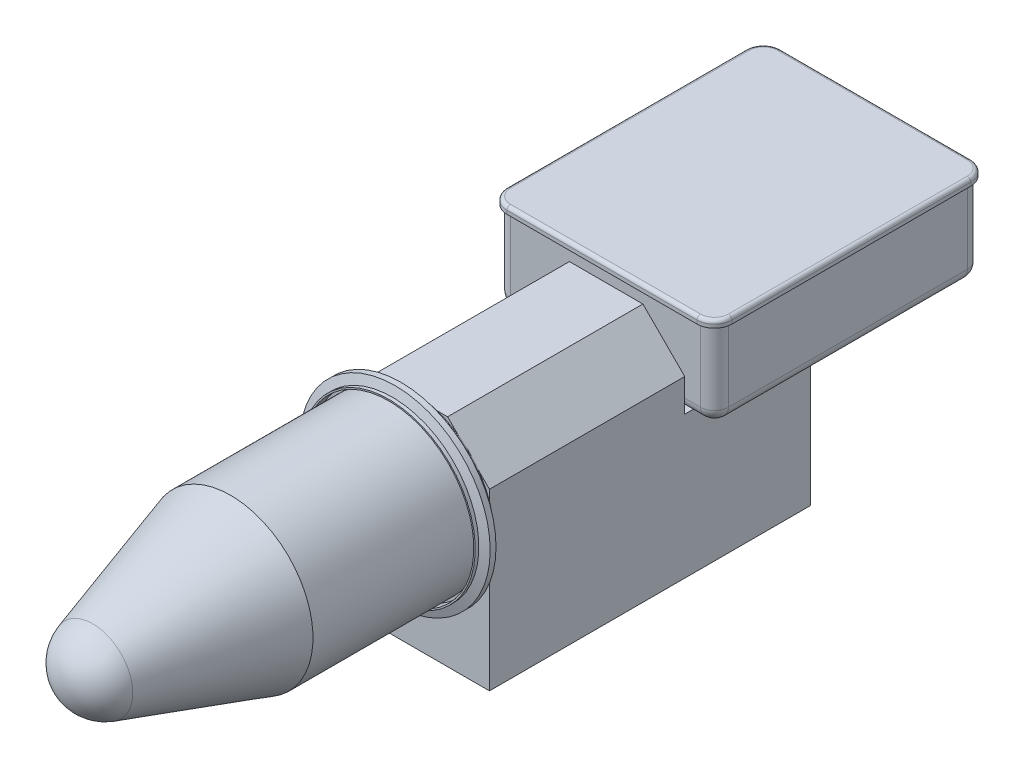
from build123d import *

# Parameters (mm, degrees)
CE_00_PYRAMID_FACE_DEPTH    = 152.4
CP_00_PYRAMID_FACES_COUNT   = 4
BOSS_EXTRUDE1_DEPTH         = 584.2
SKETCH12_W                  = 287.368195874
SKETCH12_H                  = 287.368195874
CUT_EXTRUDE6_DEPTH          = 254
SHELL8_START                = -1180.42182
SHELL8_OUTLINE_W            = 281.686
SHELL8_OUTLINE_H            = 254
SHELL8_DEPTH                = 565.15
SHELL8_START_2              = -959.74662
SHELL8_2_DEPTH              = 344.4748
SHELL8_START_3              = -615.27182
SHELL8_3_OUTLINE_R          = 101.6
SHELL8_3_DEPTH              = 6.35
SHELL8_START_4              = -1193.12182
SHELL8_4_OUTLINE_R          = 34.1376
SHELL8_4_DEPTH              = 12.7
SH_00_DOME_SHELL_T          = -2.54
SKETCH8_W                   = 485.78
SKETCH8_H                   = 169.88
BE_00_PAX_CASE_BOTTOM_DEPTH = 198.4375
FILLET1_R                   = 25.4
FILLET2_R                   = 22.86
BE_00_PAX_CASE_TOP_DEPTH    = 12.7
FILLET3_R                   = 6.35
SKETCH16_R                  = 25.4
SKETCH16_R_2                = 23.749


# Read off the part's stored shape, not the designer's step: Shell8
with BuildPart() as part:
    # Sketch1 → BR-00 Base Plate & Feed (revolve)
    with BuildSketch(Plane(origin=(0, 0, 0), x_dir=(0, 0, -1), z_dir=(1, 0, 0)), mode=Mode.PRIVATE) as br_00_base_plate_feed_sk:
        Polygon((586.69682, 155), (586.69682, 25.4), (561.29682, 25.4), (561.29682, 139.7), (17.145, 24.036960114), (17.145, 0), (862.92182, 0), (862.92182, 76.2), (850.22182, 76.2), (850.22182, 28.18076073), (698.204523227, 28.18076073), (698.204523227, 82.241223084), (608.92182, 82.241223084), (608.92182, 152.46), (597.072242205, 152.46), (597.072242205, 155), (603.678132318, 155), (603.678132318, 157.578507293), (597.072242205, 157.578507293), (592.006037356, 173.170682553), (581.387602644, 173.170682553), (576.321397795, 157.578507293), (569.715507682, 157.578507293), (569.715507682, 155), align=None)
    revolve(br_00_base_plate_feed_sk.sketch.rotate(Axis((0, 0, -724.182594249), (0, 0, 1)), 90), axis=Axis((0, 0, -724.182594249), (0, 0, 1)))

    # Sketch2 → CE-00 Pyramid Face (cut, symmetric)
    with BuildSketch(Plane(origin=(0, 0, 0), x_dir=(0, 0, -1), z_dir=(1, 0, 0))):
        Polygon((14.605, 2.575255553), (558.1142, 98.410591777), (558.1142, 230.90250219), (14.605, 230.90250219), align=None)
    ce_00_pyramid_face = extrude(amount=CE_00_PYRAMID_FACE_DEPTH, both=True, mode=Mode.SUBTRACT)

    # CP-00 Pyramid Faces: CE-00 Pyramid Face ×4 about axis
    cp_00_pyramid_faces_axis = Axis((0, 0, 0), (0, 0, 1))
    for i in range(1, CP_00_PYRAMID_FACES_COUNT):
        add(ce_00_pyramid_face.rotate(cp_00_pyramid_faces_axis, i * 360 / CP_00_PYRAMID_FACES_COUNT), mode=Mode.SUBTRACT)


with BuildPart() as body_2:
    # Sketch3 → Boss-Extrude1 (new body)
    with BuildSketch(Plane(origin=(0, 0, -608.92182), x_dir=(-1, 0, 0), z_dir=(0, 0, -1))):
        Polygon((65.786, 144.272), (-68.072, 144.272), (-144.272, 68.072), (-144.272, -249.936), (141.986, -249.936), (141.986, 68.072), align=None)
    extrude(amount=BOSS_EXTRUDE1_DEPTH)

    # Sketch12 → Cut-Extrude6 (cut, symmetric)
    with BuildSketch(Plane(origin=(0, 0, 0), x_dir=(0, 0, -1), z_dir=(1, 0, 0))):
        with Locations((1108.205917937, 152.320097937)):
            Rectangle(SKETCH12_W, SKETCH12_H)
    extrude(amount=CUT_EXTRUDE6_DEPTH, both=True, mode=Mode.SUBTRACT)

    # Shell8 outline → Shell8 (cut)
    with BuildSketch(Plane.XY.offset(SHELL8_START)):
        with Locations((1.143, -120.65)):
            Rectangle(SHELL8_OUTLINE_W, SHELL8_OUTLINE_H)
    extrude(amount=SHELL8_DEPTH, mode=Mode.SUBTRACT)

    # Shell8 2 outline → Shell8 2 (cut)
    with BuildSketch(Plane.XY.offset(SHELL8_START_2)):
        Polygon((141.986, 6.35), (141.986, 67.125107796), (67.125107796, 141.986), (-64.839107796, 141.986), (-139.7, 67.125107796), (-139.7, 6.35), align=None)
    extrude(amount=SHELL8_2_DEPTH, mode=Mode.SUBTRACT)

    # Shell8 3 outline → Shell8 3 (cut)
    with BuildSketch(Plane.XY.offset(SHELL8_START_3)):
        Circle(SHELL8_3_OUTLINE_R)
    extrude(amount=SHELL8_3_DEPTH, mode=Mode.SUBTRACT)

    # Shell8 4 outline → Shell8 4 (cut)
    with BuildSketch(Plane.XY.offset(SHELL8_START_4)):
        with Locations((57.15, -57.15)):
            Circle(SHELL8_4_OUTLINE_R)
        with Locations((-57.15, -57.15)):
            Circle(SHELL8_4_OUTLINE_R)
    extrude(amount=SHELL8_4_DEPTH, mode=Mode.SUBTRACT)


with BuildPart() as body_3:
    # Sketch5 → BR-00 Dome Body (revolve)
    with BuildSketch(Plane(origin=(0, 0, 0), x_dir=(0, 0, -1), z_dir=(1, 0, 0)), mode=Mode.PRIVATE) as br_00_dome_body_sk:
        with BuildLine():
            Line((586.69682, 150), (281.89682, 150))
            Line((281.89682, 150), (30.904445372, 72.835578933))
            ThreePointArc((30.904445372, 72.835578933), (-7.992408037, 45.277704521), (-22.90318, 0))
            Line((-22.90318, 0), (586.69682, 0))
            Line((586.69682, 0), (586.69682, 150))
        make_face()
    revolve(br_00_dome_body_sk.sketch.rotate(Axis((0, 0, 128.620665572), (0, 0, 1)), 90), axis=Axis((0, 0, 128.620665572), (0, 0, 1)))

    # SH-00 Dome Shell
    sh_00_dome_shell_openings = [body_3.faces().sort_by_distance(p)[0] for p in [
        (0, 0, -586.69682),
    ]]
    offset(amount=SH_00_DOME_SHELL_T, openings=sh_00_dome_shell_openings, kind=Kind.INTERSECTION)


with BuildPart() as body_4:
    # Sketch8 → BE-00 PAX Case Bottom (new, symmetric)
    with BuildSketch(Plane(origin=(0, 0, 0), x_dir=(0, 0, -1), z_dir=(1, 0, 0))):
        with Locations((1207.41182, 96.0652)):
            Rectangle(SKETCH8_W, SKETCH8_H)
    extrude(amount=BE_00_PAX_CASE_BOTTOM_DEPTH, both=True)

    # Fillet1
    fillet1_edges = [body_4.edges().sort_by_distance(p)[0] for p in [
        (198.4375, 96.0652, -1450.30182),
        (198.4375, 96.0652, -964.52182),
        (-198.4375, 96.0652, -1450.30182),
        (-198.4375, 96.0652, -964.52182),
    ]]
    fillet(fillet1_edges, radius=FILLET1_R)

    # Fillet2
    fillet2_edges = [body_4.edges().sort_by_distance(p)[0] for p in [
        (0, 11.1252, -1450.30182),
        (-198.4375, 11.1252, -1207.41182),
        (198.4375, 11.1252, -1207.41182),
        (0, 11.1252, -964.52182),
        (190.998012242, 11.1252, -971.961307758),
        (-190.998012242, 11.1252, -971.961307758),
        (190.998012242, 11.1252, -1442.862332242),
        (-190.998012242, 11.1252, -1442.862332242),
    ]]
    fillet(fillet2_edges, radius=FILLET2_R)

    # Sketch9 → BE-00 PAX Case Top (add)
    with BuildSketch(Plane(origin=(0, 181.0052, 0), x_dir=(1, 0, 0), z_dir=(0, 1, 0))):
        with BuildLine():
            Line((173.0375, 1456.65182), (-173.0375, 1456.65182))
            ThreePointArc((-173.0375, 1456.65182), (-195.488140303, 1447.352460303), (-204.7875, 1424.90182))
            Line((-204.7875, 1424.90182), (-204.7875, 989.92182))
            ThreePointArc((-204.7875, 989.92182), (-195.488140303, 967.471179697), (-173.0375, 958.17182))
            Line((-173.0375, 958.17182), (173.0375, 958.17182))
            ThreePointArc((173.0375, 958.17182), (195.488140303, 967.471179697), (204.7875, 989.92182))
            Line((204.7875, 989.92182), (204.7875, 1424.90182))
            ThreePointArc((204.7875, 1424.90182), (195.488140303, 1447.352460303), (173.0375, 1456.65182))
        make_face()
    extrude(amount=-BE_00_PAX_CASE_TOP_DEPTH)

    # Fillet3
    fillet3_edges = [body_4.edges().sort_by_distance(p)[0] for p in [
        (195.488140303, 181.0052, -1447.352460303),
        (0, 181.0052, -1456.65182),
        (-195.488140303, 181.0052, -1447.352460303),
        (-204.7875, 181.0052, -1207.41182),
        (-195.488140303, 181.0052, -967.471179697),
        (0, 181.0052, -958.17182),
        (195.488140303, 181.0052, -967.471179697),
        (204.7875, 181.0052, -1207.41182),
    ]]
    fillet(fillet3_edges, radius=FILLET3_R)

    # Sweep1: sweep along a path in Sketch15
    with BuildLine(Plane(origin=(0, -573.172241753, -992.763444205), x_dir=(0, -0.8660254037844386, 0.5000000000000001), z_dir=(0, 0.5000000000000001, 0.8660254037844386))) as sweep1_path:
        Line((-762.676751591, -198.4375), (-762.676751591, -223.8375))
        ThreePointArc((-762.676751591, -223.8375), (-753.48967544, -252.975182967), (-729.251374872, -271.573885136))
        Line((-729.251374872, -271.573885136), (-669.580893452, -293.292164237))
    # Sketch16 → Sweep1 (sweep)
    with BuildSketch(Plane.ZY.offset(198.4375)):
        with Locations((-1374.10182, 87.3252)):
            Circle(SKETCH16_R)
        with Locations((-1374.10182, 87.3252)):
            Circle(SKETCH16_R_2, mode=Mode.SUBTRACT)
    sweep(path=sweep1_path.line)


solid = Compound([part.part, body_2.part, body_3.part, body_4.part])
